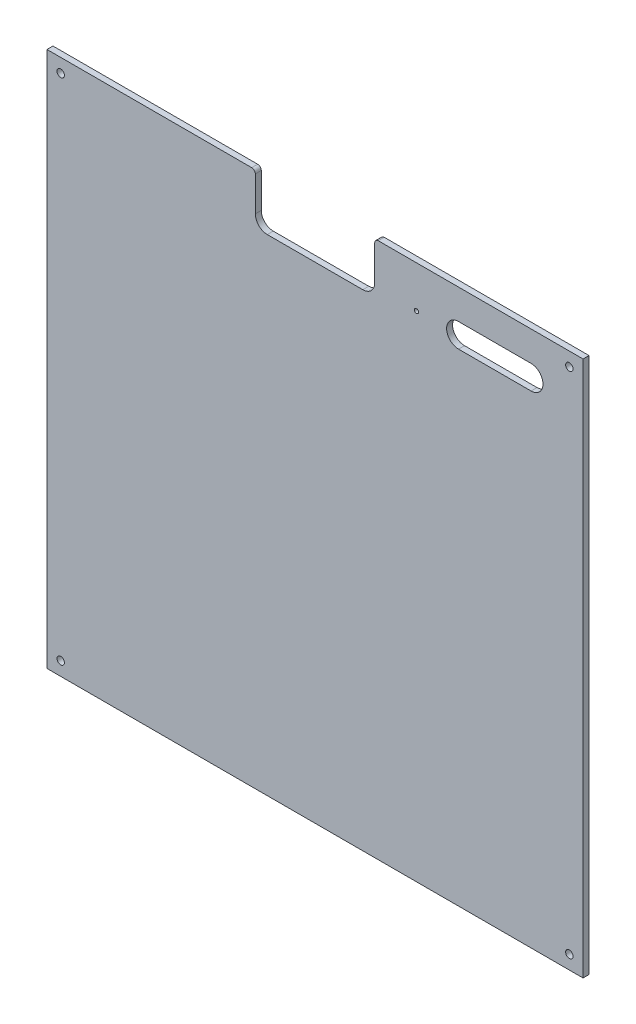
from build123d import *

# Parameters (mm, degrees)
SCHIZZO1_R                   = 3.1
SCHIZZO1_R_2                 = 1.75
ESTRUSIONE_ESTRUSIONE1_DEPTH = 5


with BuildPart() as part:
    # Schizzo1 → Estrusione-Estrusione1 (new body)
    with BuildSketch(Plane.XY):
        with BuildLine():
            Line((0, 0), (0, 449))
            Line((0, 449), (171.5, 449))
            ThreePointArc((171.5, 449), (173.621320344, 448.121320344), (174.5, 446))
            Line((174.5, 446), (174.5, 417))
            ThreePointArc((174.5, 417), (177.428932188, 409.928932188), (184.5, 407))
            Line((184.5, 407), (264.5, 407))
            ThreePointArc((264.5, 407), (271.571067812, 409.928932188), (274.5, 417))
            Line((274.5, 417), (274.5, 446))
            ThreePointArc((274.5, 446), (275.378679656, 448.121320344), (277.5, 449))
            Line((277.5, 449), (449, 449))
            Line((449, 449), (449, 0))
            Line((449, 0), (0, 0))
        make_face()
        with Locations((11.5, 11.5)):
            Circle(SCHIZZO1_R, mode=Mode.SUBTRACT)
        with Locations((437.5, 11.5)):
            Circle(SCHIZZO1_R, mode=Mode.SUBTRACT)
        with Locations((437.5, 437.5)):
            Circle(SCHIZZO1_R, mode=Mode.SUBTRACT)
        with Locations((11.5, 437.5)):
            Circle(SCHIZZO1_R, mode=Mode.SUBTRACT)
        with Locations((309.5, 414)):
            Circle(SCHIZZO1_R_2, mode=Mode.SUBTRACT)
        with BuildLine():
            Line((344.715899345, 424), (405.440355678, 424))
            ThreePointArc((405.440355678, 424), (415.440355678, 414), (405.440355678, 404))
            Line((405.440355678, 404), (344.715899345, 404))
            ThreePointArc((344.715899345, 404), (334.715899345, 414), (344.715899345, 424))
        make_face(mode=Mode.SUBTRACT)
    extrude(amount=ESTRUSIONE_ESTRUSIONE1_DEPTH)


solid = part.part
